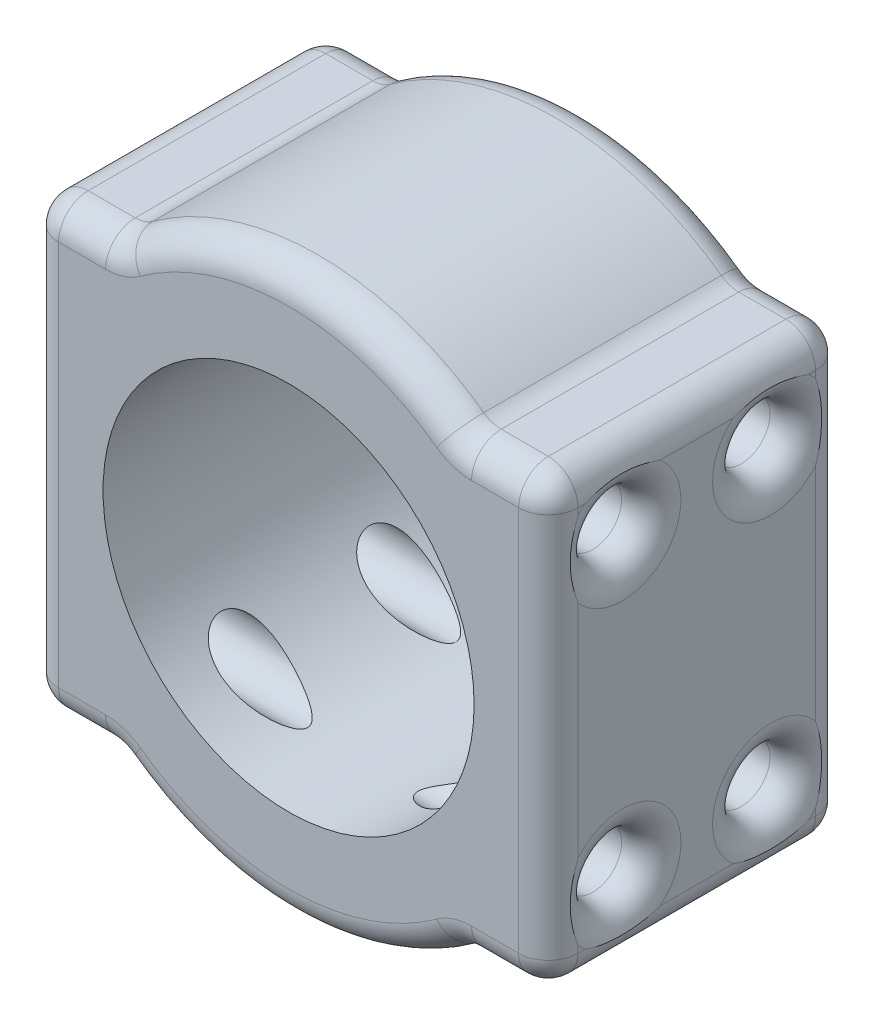
from build123d import *

# Parameters (mm, degrees)
SKETCH1_R                    = 15.875
BOSS_EXTRUDE1_DEPTH          = 25.4
F_10_0_1935_DIAMETER_HOLE1_D = 4.9149
FILLET2_R                    = 2.54


with BuildPart() as part:
    # Sketch1 → Boss-Extrude1 (new body)
    # profile 1 of 13: a face of its own
    with BuildSketch(Plane.XY):
        with BuildLine():
            Line((-19.05, 14.810617813), (-19.05, 19.05))
            Line((-19.05, 19.05), (-22.225, 19.05))
            Line((-22.225, 19.05), (-22.225, 9.397141853))
            ThreePointArc((-22.225, 9.397141853), (-20.814246005, 12.207541245), (-19.05, 14.810617813))
        make_face()
    # profile 2 of 13: a face of its own
    with BuildSketch(Plane.XY):
        with BuildLine():
            Line((-14.810617813, 19.05), (-19.05, 19.05))
            Line((-19.05, 19.05), (-19.05, 14.810617813))
            ThreePointArc((-19.05, 14.810617813), (-17.06248663, 17.06248663), (-14.810617813, 19.05))
        make_face()
    # profile 3 of 13: a face of its own
    with BuildSketch(Plane.XY):
        with BuildLine():
            ThreePointArc((-14.810617813, 19.05), (-17.06248663, 17.06248663), (-19.05, 14.810617813))
            Line((-19.05, 14.810617813), (-19.05, 0))
            ThreePointArc((-19.05, 0), (-13.470384182, 13.470384182), (0, 19.05))
            Line((0, 19.05), (-14.810617813, 19.05))
        make_face()
    # profile 4 of 13: a face of its own
    with BuildSketch(Plane.XY):
        with BuildLine():
            Line((-19.05, 0), (-19.05, 14.810617813))
            ThreePointArc((-19.05, 14.810617813), (-20.814246005, 12.207541245), (-22.225, 9.397141853))
            Line((-22.225, 9.397141853), (-22.225, -9.397141853))
            ThreePointArc((-22.225, -9.397141853), (-20.814246005, -12.207541245), (-19.05, -14.810617813))
            Line((-19.05, -14.810617813), (-19.05, 0))
        make_face()
    # profile 5 of 13: a face of its own
    with BuildSketch(Plane.XY):
        with BuildLine():
            ThreePointArc((14.810617813, 19.05), (0, 24.13), (-14.810617813, 19.05))
            Line((-14.810617813, 19.05), (0, 19.05))
            Line((0, 19.05), (14.810617813, 19.05))
        make_face()
    # profile 6 of 13: a face of its own
    with BuildSketch(Plane.XY):
        with BuildLine():
            ThreePointArc((0, -19.05), (-13.470384182, -13.470384182), (-19.05, 0))
            Line((-19.05, 0), (-19.05, -14.810617813))
            ThreePointArc((-19.05, -14.810617813), (-17.06248663, -17.06248663), (-14.810617813, -19.05))
            Line((-14.810617813, -19.05), (0, -19.05))
        make_face()
    # profile 7 of 13: a face of its own
    with BuildSketch(Plane.XY):
        with BuildLine():
            ThreePointArc((0, 19.05), (-13.470384182, 13.470384182), (-19.05, 0))
            ThreePointArc((-19.05, 0), (-13.470384182, -13.470384182), (0, -19.05))
            ThreePointArc((0, -19.05), (13.470384182, -13.470384182), (19.05, 0))
            ThreePointArc((19.05, 0), (13.470384182, 13.470384182), (0, 19.05))
        make_face()
        Circle(SKETCH1_R, mode=Mode.SUBTRACT)
    # profile 8 of 13: a face of its own
    with BuildSketch(Plane.XY):
        with BuildLine():
            Line((14.810617813, 19.05), (0, 19.05))
            ThreePointArc((0, 19.05), (13.470384182, 13.470384182), (19.05, 0))
            ThreePointArc((19.05, 0), (13.470384182, -13.470384182), (0, -19.05))
            Line((0, -19.05), (14.810617813, -19.05))
            ThreePointArc((14.810617813, -19.05), (19.136448581, -14.69874946), (22.225, -9.397141853))
            Line((22.225, -9.397141853), (22.225, 9.397141853))
            ThreePointArc((22.225, 9.397141853), (19.136448581, 14.69874946), (14.810617813, 19.05))
        make_face()
    # profile 9 of 13: a face of its own
    with BuildSketch(Plane.XY):
        with BuildLine():
            Line((19.05, 19.05), (14.810617813, 19.05))
            ThreePointArc((14.810617813, 19.05), (19.136448581, 14.69874946), (22.225, 9.397141853))
            Line((22.225, 9.397141853), (22.225, 19.05))
            Line((22.225, 19.05), (19.05, 19.05))
        make_face()
    # profile 10 of 13: a face of its own
    with BuildSketch(Plane.XY):
        with BuildLine():
            ThreePointArc((-19.05, -14.810617813), (-20.814246005, -12.207541245), (-22.225, -9.397141853))
            Line((-22.225, -9.397141853), (-22.225, -19.05))
            Line((-22.225, -19.05), (-19.05, -19.05))
            Line((-19.05, -19.05), (-19.05, -14.810617813))
        make_face()
    # profile 11 of 13: a face of its own
    with BuildSketch(Plane.XY):
        with BuildLine():
            ThreePointArc((-14.810617813, -19.05), (-17.06248663, -17.06248663), (-19.05, -14.810617813))
            Line((-19.05, -14.810617813), (-19.05, -19.05))
            Line((-19.05, -19.05), (-14.810617813, -19.05))
        make_face()
    # profile 12 of 13: a face of its own
    with BuildSketch(Plane.XY):
        with BuildLine():
            Line((14.810617813, -19.05), (0, -19.05))
            Line((0, -19.05), (-14.810617813, -19.05))
            ThreePointArc((-14.810617813, -19.05), (0, -24.13), (14.810617813, -19.05))
        make_face()
    # profile 13 of 13: a face of its own
    with BuildSketch(Plane.XY):
        with BuildLine():
            ThreePointArc((22.225, -9.397141853), (19.136448581, -14.69874946), (14.810617813, -19.05))
            Line((14.810617813, -19.05), (19.05, -19.05))
            Line((19.05, -19.05), (22.225, -19.05))
            Line((22.225, -19.05), (22.225, -9.397141853))
        make_face()
    extrude(amount=BOSS_EXTRUDE1_DEPTH)

    # #10 (0.1935) Diameter Hole1 (through all)
    with Locations(Plane.ZY.offset(22.225)):
        with Locations((6.35, 12.7), (6.35, -12.7), (19.05, -12.7), (19.05, 12.7)):
            Hole(F_10_0_1935_DIAMETER_HOLE1_D / 2)

    # Fillet2
    # the kernel refuses this fillet: 2.54 mm, written as the material it adds along each edge
    with BuildSketch(Plane(origin=(-14.810617813, -19.05, 0), x_dir=(-1, 0, 0), z_dir=(0, 0, 1))) as fillet2_piece_1:
        with BuildLine():
            CenterArc((0.846993755, 2.54), FILLET2_R, 234.04943238, 35.95056762)
            ThreePointArc((-0.644207347, 0.483809524), (-0.320084355, 0.244593546), (0, 0))
            Line((0, 0), (0.846993755, 0))
        make_face()
    extrude(amount=25.4)
    with BuildSketch(Plane(origin=(-14.810617813, 19.05, 0), x_dir=(-1, 0, 0), z_dir=(0, 0, 1))) as fillet2_piece_2:
        with BuildLine():
            CenterArc((0.846993755, -2.54), FILLET2_R, 90, 35.95056762)
            ThreePointArc((-0.644207347, -0.483809524), (-0.320084355, -0.244593546), (0, 0))
            Line((0, 0), (0.846993755, 0))
        make_face()
    extrude(amount=25.4)
    with BuildSketch(Plane(origin=(14.810617813, 19.05, 0), x_dir=(-0.7996101759780326, 0.6005194139013155, 0), z_dir=(0, 0, 1))) as fillet2_piece_3:
        with BuildLine():
            CenterArc((0.848054486, -2.53964604), FILLET2_R, 90.956539371, 35.95056762)
            Line((-0.677264825, -0.508636193), (0, 0))
            ThreePointArc((0, 0), (0.402825881, -0.003362619), (0.805651762, 0))
        make_face()
    extrude(amount=25.4)
    with BuildSketch(Plane(origin=(14.810617813, -19.05, 0), x_dir=(-0.7996101759780377, -0.6005194139013088, 0), z_dir=(0, 0, 1))) as fillet2_piece_4:
        with BuildLine():
            CenterArc((0.848054486, 2.53964604), FILLET2_R, 233.092893009, 35.95056762)
            Line((-0.677264825, 0.508636193), (0, 0))
            ThreePointArc((0, 0), (0.402825881, 0.003362619), (0.805651762, 0))
        make_face()
    extrude(amount=25.4)
    # the kernel refuses this fillet: 2.54 mm, written as the material it takes off along each edge
    with BuildSketch(Plane(origin=(-22.225, 25.4, 0), x_dir=(0, 0, 1), z_dir=(0, -1, 0)), Plane(origin=(22.225, -25.4, 25.4), x_dir=(-1, 0, 0), z_dir=(0, 1, 0)), Plane(origin=(22.225, 25.4, 0), x_dir=(-1, 0, 0), z_dir=(0, -1, 0)), Plane(origin=(-22.225, -25.4, 25.4), x_dir=(0, 0, -1), z_dir=(0, 1, 0))) as fillet2_2_piece_1:
        with BuildLine():
            CenterArc((FILLET2_R, -FILLET2_R), FILLET2_R, 90, 90)
            Line((0, -FILLET2_R), (0, 0))
            Line((0, 0), (FILLET2_R, 0))
        make_face()
    extrude(amount=50.8, mode=Mode.SUBTRACT)
    with BuildSketch(Plane(origin=(-22.225, -19.05, -6.35), x_dir=(0, 1, 0), z_dir=(0, 0, 1)), Plane(origin=(-22.225, 19.05, -6.35), x_dir=(1, 0, 0), z_dir=(0, 0, 1)), Plane(origin=(22.225, 19.05, -6.35), x_dir=(0, -1, 0), z_dir=(0, 0, 1)), Plane(origin=(22.225, -19.05, -6.35), x_dir=(-1, 0, 0), z_dir=(0, 0, 1))) as fillet2_2_piece_2:
        with BuildLine():
            CenterArc((FILLET2_R, -FILLET2_R), FILLET2_R, 90, 90)
            Line((0, -FILLET2_R), (0, 0))
            Line((0, 0), (FILLET2_R, 0))
        make_face()
    extrude(amount=38.1, mode=Mode.SUBTRACT)
    with BuildSketch(Plane(origin=(22.225, 12.7, 19.05), x_dir=(0, 0, -1), z_dir=(0, -1, 0))) as fillet2_2_piece_3:
        with BuildLine():
            CenterArc((2.45745 + FILLET2_R, -FILLET2_R), FILLET2_R, 90, 90)
            Line((2.45745, -FILLET2_R), (2.45745, 0))
            Line((2.45745, 0), (2.45745 + FILLET2_R, 0))
        make_face()
    revolve(axis=Axis((22.225, 12.7, 19.05), (1, 0, 0)), mode=Mode.SUBTRACT)
    with BuildSketch(Plane(origin=(-22.225, 12.7, 19.05), x_dir=(0, 0, -1), z_dir=(0, -1, 0))) as fillet2_2_piece_4:
        with BuildLine():
            CenterArc((2.45745 + FILLET2_R, FILLET2_R), FILLET2_R, 180, 90)
            Line((2.45745, FILLET2_R), (2.45745, 0))
            Line((2.45745, 0), (2.45745 + FILLET2_R, 0))
        make_face()
    revolve(axis=Axis((-22.225, 12.7, 19.05), (1, 0, 0)), mode=Mode.SUBTRACT)
    with BuildSketch(Plane(origin=(22.225, -12.7, 19.05), x_dir=(0, 0, -1), z_dir=(0, -1, 0))) as fillet2_2_piece_5:
        with BuildLine():
            CenterArc((2.45745 + FILLET2_R, -FILLET2_R), FILLET2_R, 90, 90)
            Line((2.45745, -FILLET2_R), (2.45745, 0))
            Line((2.45745, 0), (2.45745 + FILLET2_R, 0))
        make_face()
    revolve(axis=Axis((22.225, -12.7, 19.05), (1, 0, 0)), mode=Mode.SUBTRACT)
    with BuildSketch(Plane(origin=(-22.225, -12.7, 19.05), x_dir=(0, 0, -1), z_dir=(0, -1, 0))) as fillet2_2_piece_6:
        with BuildLine():
            CenterArc((2.45745 + FILLET2_R, FILLET2_R), FILLET2_R, 180, 90)
            Line((2.45745, FILLET2_R), (2.45745, 0))
            Line((2.45745, 0), (2.45745 + FILLET2_R, 0))
        make_face()
    revolve(axis=Axis((-22.225, -12.7, 19.05), (1, 0, 0)), mode=Mode.SUBTRACT)
    with BuildSketch(Plane(origin=(22.225, -12.7, 6.35), x_dir=(0, 0, -1), z_dir=(0, -1, 0))) as fillet2_2_piece_7:
        with BuildLine():
            CenterArc((2.45745 + FILLET2_R, -FILLET2_R), FILLET2_R, 90, 90)
            Line((2.45745, -FILLET2_R), (2.45745, 0))
            Line((2.45745, 0), (2.45745 + FILLET2_R, 0))
        make_face()
    revolve(axis=Axis((22.225, -12.7, 6.35), (1, 0, 0)), mode=Mode.SUBTRACT)
    with BuildSketch(Plane(origin=(-22.225, -12.7, 6.35), x_dir=(0, 0, -1), z_dir=(0, -1, 0))) as fillet2_2_piece_8:
        with BuildLine():
            CenterArc((2.45745 + FILLET2_R, FILLET2_R), FILLET2_R, 180, 90)
            Line((2.45745, FILLET2_R), (2.45745, 0))
            Line((2.45745, 0), (2.45745 + FILLET2_R, 0))
        make_face()
    revolve(axis=Axis((-22.225, -12.7, 6.35), (1, 0, 0)), mode=Mode.SUBTRACT)
    with BuildSketch(Plane(origin=(22.225, 12.7, 6.35), x_dir=(0, 0, -1), z_dir=(0, -1, 0))) as fillet2_2_piece_9:
        with BuildLine():
            CenterArc((2.45745 + FILLET2_R, -FILLET2_R), FILLET2_R, 90, 90)
            Line((2.45745, -FILLET2_R), (2.45745, 0))
            Line((2.45745, 0), (2.45745 + FILLET2_R, 0))
        make_face()
    revolve(axis=Axis((22.225, 12.7, 6.35), (1, 0, 0)), mode=Mode.SUBTRACT)
    with BuildSketch(Plane(origin=(-22.225, 12.7, 6.35), x_dir=(0, 0, -1), z_dir=(0, -1, 0))) as fillet2_2_piece_10:
        with BuildLine():
            CenterArc((2.45745 + FILLET2_R, FILLET2_R), FILLET2_R, 180, 90)
            Line((2.45745, FILLET2_R), (2.45745, 0))
            Line((2.45745, 0), (2.45745 + FILLET2_R, 0))
        make_face()
    revolve(axis=Axis((-22.225, 12.7, 6.35), (1, 0, 0)), mode=Mode.SUBTRACT)
    # the kernel refuses this fillet: 2.54 mm, written as the material it takes off along each edge
    with BuildSketch(Plane(origin=(19.685, -16.51, 22.86), x_dir=(0, -1, 0), z_dir=(0, 0, 1))) as fillet2_3_piece_1_section:
        Polygon((0, 0), (FILLET2_R, 0), (FILLET2_R, FILLET2_R), (0, FILLET2_R), align=None)
    fillet2_3_piece_1 = extrude(amount=FILLET2_R, mode=Mode.PRIVATE)
    fillet2_3_piece_1 = fillet2_3_piece_1 - Plane(origin=(19.685, -16.51, 22.86), x_dir=(-0.7071067811865475, 0.7071067811865475, 0), z_dir=(0, 0, 1)) * Sphere(FILLET2_R, mode=Mode.PRIVATE)
    add(fillet2_3_piece_1, mode=Mode.SUBTRACT)
    with BuildSketch(Plane(origin=(-19.685, -16.51, 22.86), x_dir=(0, -1, 0), z_dir=(0, 0, 1))) as fillet2_3_piece_2_section:
        Polygon((0, 0), (FILLET2_R, 0), (FILLET2_R, -FILLET2_R), (0, -FILLET2_R), align=None)
    fillet2_3_piece_2 = extrude(amount=FILLET2_R, mode=Mode.PRIVATE)
    fillet2_3_piece_2 = fillet2_3_piece_2 - Plane(origin=(-19.685, -16.51, 22.86), x_dir=(0.7071067811865475, 0.7071067811865475, 0), z_dir=(0, 0, 1)) * Sphere(FILLET2_R, mode=Mode.PRIVATE)
    add(fillet2_3_piece_2, mode=Mode.SUBTRACT)
    with BuildSketch(Plane(origin=(-19.685, 16.51, 22.86), x_dir=(0, 0, 1), z_dir=(0, 1, 0))) as fillet2_3_piece_3_section:
        Polygon((0, 0), (FILLET2_R, 0), (FILLET2_R, -FILLET2_R), (0, -FILLET2_R), align=None)
    fillet2_3_piece_3 = extrude(amount=FILLET2_R, mode=Mode.PRIVATE)
    fillet2_3_piece_3 = fillet2_3_piece_3 - Plane(origin=(-19.685, 16.51, 22.86), x_dir=(0.7071067811865475, 0, -0.7071067811865475), z_dir=(0, 1, 0)) * Sphere(FILLET2_R, mode=Mode.PRIVATE)
    add(fillet2_3_piece_3, mode=Mode.SUBTRACT)
    with BuildSketch(Plane(origin=(19.685, 16.51, 22.86), x_dir=(0, 1, 0), z_dir=(0, 0, 1))) as fillet2_3_piece_4_section:
        Polygon((0, 0), (FILLET2_R, 0), (FILLET2_R, -FILLET2_R), (0, -FILLET2_R), align=None)
    fillet2_3_piece_4 = extrude(amount=FILLET2_R, mode=Mode.PRIVATE)
    fillet2_3_piece_4 = fillet2_3_piece_4 - Plane(origin=(19.685, 16.51, 22.86), x_dir=(-0.7071067811865475, -0.7071067811865475, 0), z_dir=(0, 0, 1)) * Sphere(FILLET2_R, mode=Mode.PRIVATE)
    add(fillet2_3_piece_4, mode=Mode.SUBTRACT)
    with BuildSketch(Plane(origin=(19.685, -16.51, 2.54), x_dir=(0, -1, 0), z_dir=(0, 0, -1))) as fillet2_3_piece_5_section:
        Polygon((0, 0), (FILLET2_R, 0), (FILLET2_R, -FILLET2_R), (0, -FILLET2_R), align=None)
    fillet2_3_piece_5 = extrude(amount=FILLET2_R, mode=Mode.PRIVATE)
    fillet2_3_piece_5 = fillet2_3_piece_5 - Plane(origin=(19.685, -16.51, 2.54), x_dir=(-0.7071067811865475, 0.7071067811865475, 0), z_dir=(0, 0, -1)) * Sphere(FILLET2_R, mode=Mode.PRIVATE)
    add(fillet2_3_piece_5, mode=Mode.SUBTRACT)
    with BuildSketch(Plane(origin=(19.685, 16.51, 2.54), x_dir=(0, 1, 0), z_dir=(0, 0, -1))) as fillet2_3_piece_6_section:
        Polygon((0, 0), (FILLET2_R, 0), (FILLET2_R, FILLET2_R), (0, FILLET2_R), align=None)
    fillet2_3_piece_6 = extrude(amount=FILLET2_R, mode=Mode.PRIVATE)
    fillet2_3_piece_6 = fillet2_3_piece_6 - Plane(origin=(19.685, 16.51, 2.54), x_dir=(-0.7071067811865475, -0.7071067811865475, 0), z_dir=(0, 0, -1)) * Sphere(FILLET2_R, mode=Mode.PRIVATE)
    add(fillet2_3_piece_6, mode=Mode.SUBTRACT)
    with BuildSketch(Plane(origin=(-19.685, 16.51, 2.54), x_dir=(0, 0, -1), z_dir=(0, 1, 0))) as fillet2_3_piece_7_section:
        Polygon((0, 0), (FILLET2_R, 0), (FILLET2_R, FILLET2_R), (0, FILLET2_R), align=None)
    fillet2_3_piece_7 = extrude(amount=FILLET2_R, mode=Mode.PRIVATE)
    fillet2_3_piece_7 = fillet2_3_piece_7 - Plane(origin=(-19.685, 16.51, 2.54), x_dir=(0.7071067811865475, 0, 0.7071067811865475), z_dir=(0, 1, 0)) * Sphere(FILLET2_R, mode=Mode.PRIVATE)
    add(fillet2_3_piece_7, mode=Mode.SUBTRACT)
    with BuildSketch(Plane(origin=(-19.685, -16.51, 2.54), x_dir=(0, -1, 0), z_dir=(0, 0, -1))) as fillet2_3_piece_8_section:
        Polygon((0, 0), (FILLET2_R, 0), (FILLET2_R, FILLET2_R), (0, FILLET2_R), align=None)
    fillet2_3_piece_8 = extrude(amount=FILLET2_R, mode=Mode.PRIVATE)
    fillet2_3_piece_8 = fillet2_3_piece_8 - Plane(origin=(-19.685, -16.51, 2.54), x_dir=(0.7071067811865475, 0.7071067811865475, 0), z_dir=(0, 0, -1)) * Sphere(FILLET2_R, mode=Mode.PRIVATE)
    add(fillet2_3_piece_8, mode=Mode.SUBTRACT)
    with BuildSketch(Plane(origin=(-15.657611568, -19.05, 0), x_dir=(0, 1, 0), z_dir=(-1, 0, 0)), Plane(origin=(-15.657611568, 19.05, 0), x_dir=(0, 0, 1), z_dir=(-1, 0, 0)), Plane(origin=(-19.685, 19.05, 25.4), x_dir=(0, 0, -1), z_dir=(1, 0, 0)), Plane(origin=(-19.685, -19.05, 25.4), x_dir=(0, 1, 0), z_dir=(1, 0, 0))) as fillet2_3_piece_9:
        with BuildLine():
            CenterArc((FILLET2_R, -FILLET2_R), FILLET2_R, 90, 90)
            Line((0, -FILLET2_R), (0, 0))
            Line((0, 0), (FILLET2_R, 0))
        make_face()
    extrude(amount=4.027388432, mode=Mode.SUBTRACT)
    with BuildSketch(Plane(origin=(0, 0, 0), x_dir=(0.5870870479018081, 0.8095238095238089, 0), z_dir=(0.8095238095238089, -0.5870870479018081, 0))) as fillet2_3_piece_10:
        with BuildLine():
            CenterArc((24.13 - FILLET2_R, FILLET2_R), FILLET2_R, 270, 90)
            Line((24.13, FILLET2_R), (24.13, 0))
            Line((24.13, 0), (24.13 - FILLET2_R, 0))
        make_face()
    revolve(axis=Axis((0, 0, 0), (0, 0, 1)), revolution_arc=71.901135239, mode=Mode.SUBTRACT)
    with BuildSketch(Plane(origin=(19.685, 19.05, 0), x_dir=(0, -1, 0), z_dir=(-1, 0, 0)), Plane(origin=(15.657611568, -19.05, 0), x_dir=(0, 1, 0), z_dir=(1, 0, 0)), Plane(origin=(15.657611568, 19.05, 25.4), x_dir=(0, -1, 0), z_dir=(1, 0, 0)), Plane(origin=(19.685, -19.05, 25.4), x_dir=(0, 1, 0), z_dir=(-1, 0, 0))) as fillet2_3_piece_11:
        with BuildLine():
            CenterArc((FILLET2_R, FILLET2_R), FILLET2_R, 180, 90)
            Line((0, FILLET2_R), (0, 0))
            Line((0, 0), (FILLET2_R, 0))
        make_face()
    extrude(amount=4.027388432, mode=Mode.SUBTRACT)
    with BuildSketch(Plane(origin=(0, 0, 0), x_dir=(0.5870870479018064, -0.8095238095238102, 0), z_dir=(0.8095238095238102, 0.5870870479018064, 0))) as fillet2_3_piece_12:
        with BuildLine():
            CenterArc((24.13 - FILLET2_R, -FILLET2_R), FILLET2_R, 0, 90)
            Line((24.13, -FILLET2_R), (24.13, 0))
            Line((24.13, 0), (24.13 - FILLET2_R, 0))
        make_face()
    revolve(axis=Axis((0, 0, 0), (0, 0, -1)), revolution_arc=71.901135239, mode=Mode.SUBTRACT)
    with BuildSketch(Plane(origin=(0, 0, 25.4), x_dir=(0.5870870479018081, 0.8095238095238089, 0), z_dir=(0.8095238095238089, -0.5870870479018081, 0))) as fillet2_3_piece_13:
        with BuildLine():
            CenterArc((24.13 - FILLET2_R, -FILLET2_R), FILLET2_R, 0, 90)
            Line((24.13, -FILLET2_R), (24.13, 0))
            Line((24.13, 0), (24.13 - FILLET2_R, 0))
        make_face()
    revolve(axis=Axis((0, 0, 25.4), (0, 0, 1)), revolution_arc=71.901135239, mode=Mode.SUBTRACT)
    with BuildSketch(Plane(origin=(0, 0, 25.4), x_dir=(-0.5870870479018041, -0.8095238095238118, 0), z_dir=(-0.8095238095238118, 0.5870870479018041, 0))) as fillet2_3_piece_14:
        with BuildLine():
            CenterArc((24.13 - FILLET2_R, -FILLET2_R), FILLET2_R, 0, 90)
            Line((24.13, -FILLET2_R), (24.13, 0))
            Line((24.13, 0), (24.13 - FILLET2_R, 0))
        make_face()
    revolve(axis=Axis((0, 0, 25.4), (0, 0, 1)), revolution_arc=71.901135239, mode=Mode.SUBTRACT)
    with BuildSketch(Plane(origin=(15.657611568, -21.59, 25.4), x_dir=(-0.5870870479018068, 0.8095238095238099, 0), z_dir=(-0.8095238095238099, -0.5870870479018068, 0))) as fillet2_3_piece_15:
        with BuildLine():
            CenterArc((2.54 + FILLET2_R, FILLET2_R), FILLET2_R, 180, 90)
            Line((2.54, FILLET2_R), (2.54, 0))
            Line((2.54, 0), (2.54 + FILLET2_R, 0))
        make_face()
    revolve(axis=Axis((15.657611568, -21.59, 25.4), (0, 0, -1)), revolution_arc=35.95056762, mode=Mode.SUBTRACT)
    with BuildSketch(Plane(origin=(-15.657611568, -21.59, 25.4), x_dir=(0, 1, 0), z_dir=(-1, 0, 0))) as fillet2_3_piece_16:
        with BuildLine():
            CenterArc((2.54 + FILLET2_R, FILLET2_R), FILLET2_R, 180, 90)
            Line((2.54, FILLET2_R), (2.54, 0))
            Line((2.54, 0), (2.54 + FILLET2_R, 0))
        make_face()
    revolve(axis=Axis((-15.657611568, -21.59, 25.4), (0, 0, -1)), revolution_arc=35.95056762, mode=Mode.SUBTRACT)
    with BuildSketch(Plane(origin=(-15.657611568, 21.59, 25.4), x_dir=(0, -1, 0), z_dir=(-1, 0, 0))) as fillet2_3_piece_17:
        with BuildLine():
            CenterArc((2.54 + FILLET2_R, -FILLET2_R), FILLET2_R, 90, 90)
            Line((2.54, -FILLET2_R), (2.54, 0))
            Line((2.54, 0), (2.54 + FILLET2_R, 0))
        make_face()
    revolve(axis=Axis((-15.657611568, 21.59, 25.4), (0, 0, 1)), revolution_arc=35.95056762, mode=Mode.SUBTRACT)
    with BuildSketch(Plane(origin=(15.657611568, 21.59, 25.4), x_dir=(-0.5870870479018068, -0.8095238095238099, 0), z_dir=(-0.8095238095238099, 0.5870870479018068, 0))) as fillet2_3_piece_18:
        with BuildLine():
            CenterArc((2.54 + FILLET2_R, -FILLET2_R), FILLET2_R, 90, 90)
            Line((2.54, -FILLET2_R), (2.54, 0))
            Line((2.54, 0), (2.54 + FILLET2_R, 0))
        make_face()
    revolve(axis=Axis((15.657611568, 21.59, 25.4), (0, 0, 1)), revolution_arc=35.95056762, mode=Mode.SUBTRACT)
    with BuildSketch(Plane(origin=(15.657611568, -21.59, 0), x_dir=(-0.5870870479018068, 0.8095238095238099, 0), z_dir=(-0.8095238095238099, -0.5870870479018068, 0))) as fillet2_3_piece_19:
        with BuildLine():
            CenterArc((2.54 + FILLET2_R, -FILLET2_R), FILLET2_R, 90, 90)
            Line((2.54, -FILLET2_R), (2.54, 0))
            Line((2.54, 0), (2.54 + FILLET2_R, 0))
        make_face()
    revolve(axis=Axis((15.657611568, -21.59, 0), (0, 0, -1)), revolution_arc=35.95056762, mode=Mode.SUBTRACT)
    with BuildSketch(Plane(origin=(-15.657611568, -21.59, 0), x_dir=(0, 1, 0), z_dir=(-1, 0, 0))) as fillet2_3_piece_20:
        with BuildLine():
            CenterArc((2.54 + FILLET2_R, -FILLET2_R), FILLET2_R, 90, 90)
            Line((2.54, -FILLET2_R), (2.54, 0))
            Line((2.54, 0), (2.54 + FILLET2_R, 0))
        make_face()
    revolve(axis=Axis((-15.657611568, -21.59, 0), (0, 0, -1)), revolution_arc=35.95056762, mode=Mode.SUBTRACT)
    with BuildSketch(Plane(origin=(15.657611568, 21.59, 0), x_dir=(-0.5870870479018068, -0.8095238095238099, 0), z_dir=(-0.8095238095238099, 0.5870870479018068, 0))) as fillet2_3_piece_21:
        with BuildLine():
            CenterArc((2.54 + FILLET2_R, FILLET2_R), FILLET2_R, 180, 90)
            Line((2.54, FILLET2_R), (2.54, 0))
            Line((2.54, 0), (2.54 + FILLET2_R, 0))
        make_face()
    revolve(axis=Axis((15.657611568, 21.59, 0), (0, 0, 1)), revolution_arc=35.95056762, mode=Mode.SUBTRACT)
    with BuildSketch(Plane(origin=(-15.657611568, 21.59, 0), x_dir=(0, -1, 0), z_dir=(-1, 0, 0))) as fillet2_3_piece_22:
        with BuildLine():
            CenterArc((2.54 + FILLET2_R, FILLET2_R), FILLET2_R, 180, 90)
            Line((2.54 + FILLET2_R, 0), (2.54, 0))
            Line((2.54, 0), (2.54, FILLET2_R))
        make_face()
    revolve(axis=Axis((-15.657611568, 21.59, 0), (0, 0, 1)), revolution_arc=35.95056762, mode=Mode.SUBTRACT)


solid = part.part
